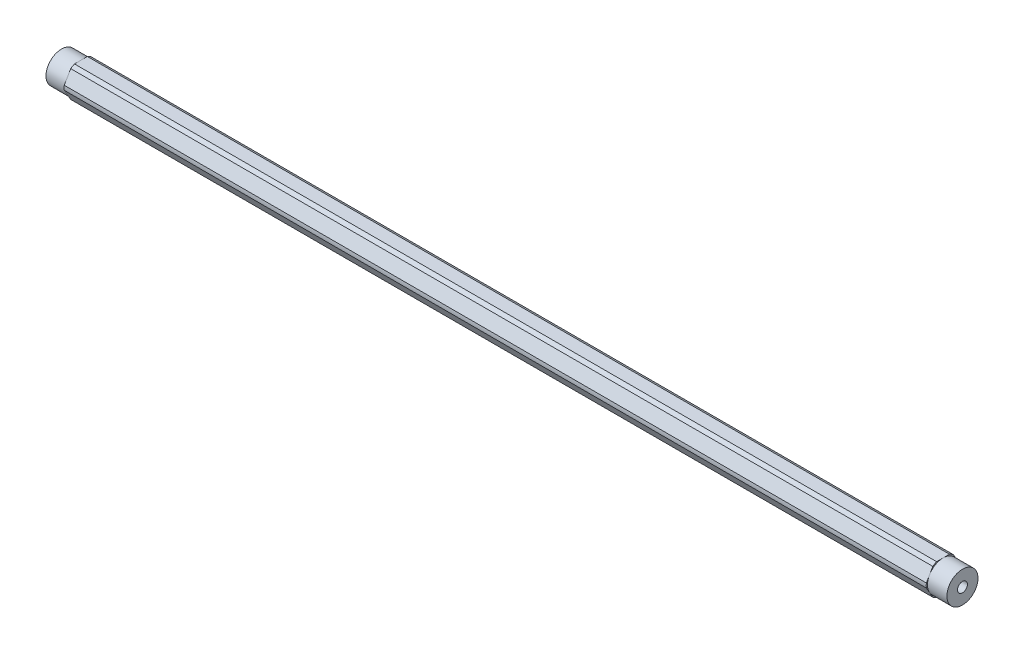
from build123d import *

# Parameters (mm, degrees)
SKETCH1_R               = 2.0193
BOSS_EXTRUDE1_DEPTH     = 184.15
SKETCH2_R               = 8.89
SKETCH2_R_2             = 6.35
CUT_EXTRUDE_THIN1_DEPTH = 7.9375


with BuildPart() as part:
    # Sketch1 → Boss-Extrude1 (new, symmetric)
    with BuildSketch(Plane(origin=(0, 0, 0), x_dir=(0, 0, -1), z_dir=(1, 0, 0))):
        with BuildLine():
            ThreePointArc((6.874999966, 0), (6.860422465, 0.447468582), (6.816751782, 0.893039571))
            Line((6.816751782, 0.893039571), (4.181770846, 5.456960429))
            ThreePointArc((4.181770846, 5.456960429), (3.437499983, 5.953924622), (2.634980936, 6.35))
            Line((2.634980936, 6.35), (-2.634980936, 6.35))
            ThreePointArc((-2.634980936, 6.35), (-3.437499983, 5.953924622), (-4.181770846, 5.456960429))
            Line((-4.181770846, 5.456960429), (-6.816751782, 0.893039571))
            ThreePointArc((-6.816751782, 0.893039571), (-6.874999966, 0), (-6.816751782, -0.893039571))
            Line((-6.816751782, -0.893039571), (-4.181770846, -5.456960429))
            ThreePointArc((-4.181770846, -5.456960429), (-3.437499983, -5.953924622), (-2.634980936, -6.35))
            Line((-2.634980936, -6.35), (2.634980936, -6.35))
            ThreePointArc((2.634980936, -6.35), (3.437499983, -5.953924622), (4.181770846, -5.456960429))
            Line((4.181770846, -5.456960429), (6.816751782, -0.893039571))
            ThreePointArc((6.816751782, -0.893039571), (6.860422465, -0.447468582), (6.874999966, 0))
        make_face()
        Circle(SKETCH1_R, mode=Mode.SUBTRACT)
    extrude(amount=BOSS_EXTRUDE1_DEPTH, both=True)

    # Sketch2 → Cut-Extrude-Thin1 (cut)
    with BuildSketch(Plane(origin=(184.15, 0, 0), x_dir=(0, 0, -1), z_dir=(1, 0, 0))):
        Circle(SKETCH2_R)
        Circle(SKETCH2_R_2, mode=Mode.SUBTRACT)
    cut_extrude_thin1 = extrude(amount=-CUT_EXTRUDE_THIN1_DEPTH, mode=Mode.SUBTRACT)

    # Mirror1: Cut-Extrude-Thin1 across plane
    add(cut_extrude_thin1.mirror(Plane(origin=(0, 0, 0), x_dir=(0, 0, 1), z_dir=(1, 0, 0))), mode=Mode.SUBTRACT)


solid = part.part
